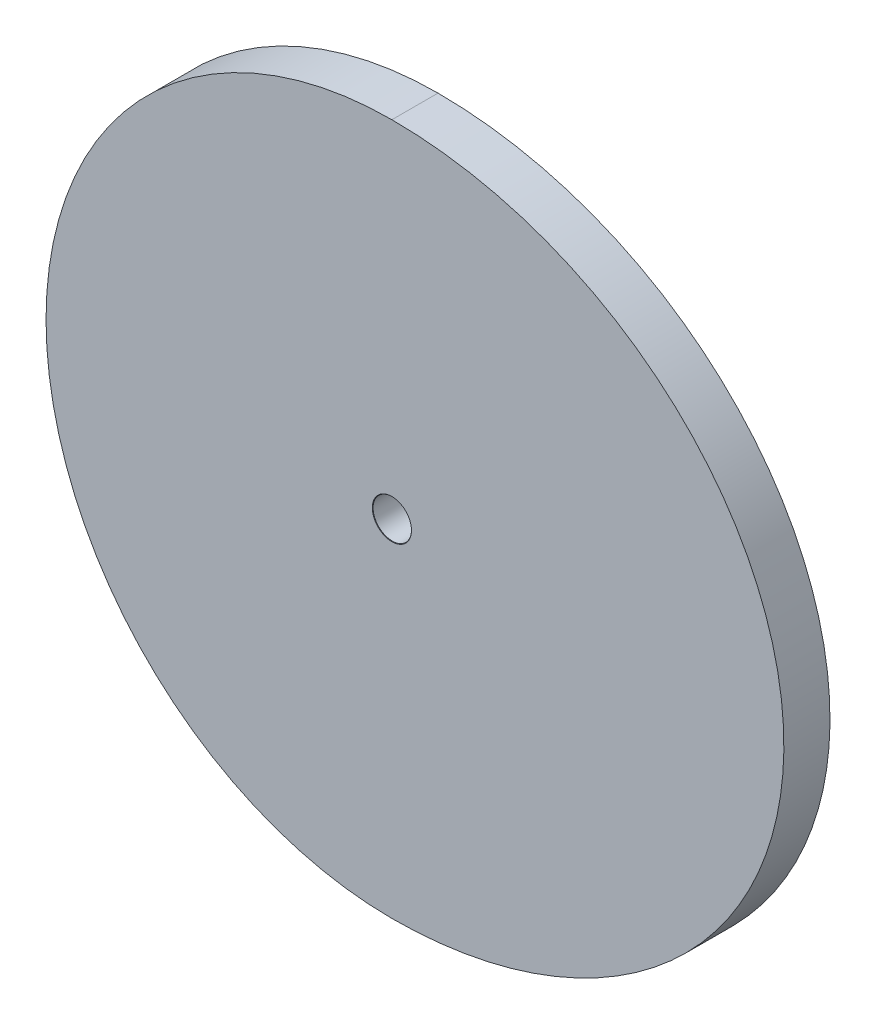
from build123d import *

# Parameters (mm, degrees)
BOSS_EXTRUDE1_DEPTH             = 3
F_2_5MM_DOWEL_HOLE1_D           = 2.5
F_2_5MM_DOWEL_HOLE1_CSINK_D     = 2.55
F_2_5MM_DOWEL_HOLE1_CSINK_ANGLE = 90


with BuildPart() as part:
    # Sketch1 → Boss-Extrude1 (new body)
    with BuildSketch(Plane.XY):
        with BuildLine():
            ThreePointArc((15.5, 22.5), (-7, 0), (15.5, -22.5))
            add(Edge.make_bspline(
                [(15.5, -22.5), (41, -22.5), (41, 0), (41, 22.5), (15.5, 22.5)],
                knots=[4.71238898, 4.71238898, 4.71238898, 6.283185307, 6.283185307, 7.853981634, 7.853981634, 7.853981634], degree=2, weights=[1, 0.707106781, 1, 0.707106781, 1]))
        make_face()
    extrude(amount=BOSS_EXTRUDE1_DEPTH)

    # Ø2.5mm Dowel Hole1 (through all)
    with Locations(Plane.XY.offset(3)):
        with Locations((15.5, 0)):
            CounterSinkHole(F_2_5MM_DOWEL_HOLE1_D / 2, F_2_5MM_DOWEL_HOLE1_CSINK_D / 2, counter_sink_angle=F_2_5MM_DOWEL_HOLE1_CSINK_ANGLE)


solid = part.part
